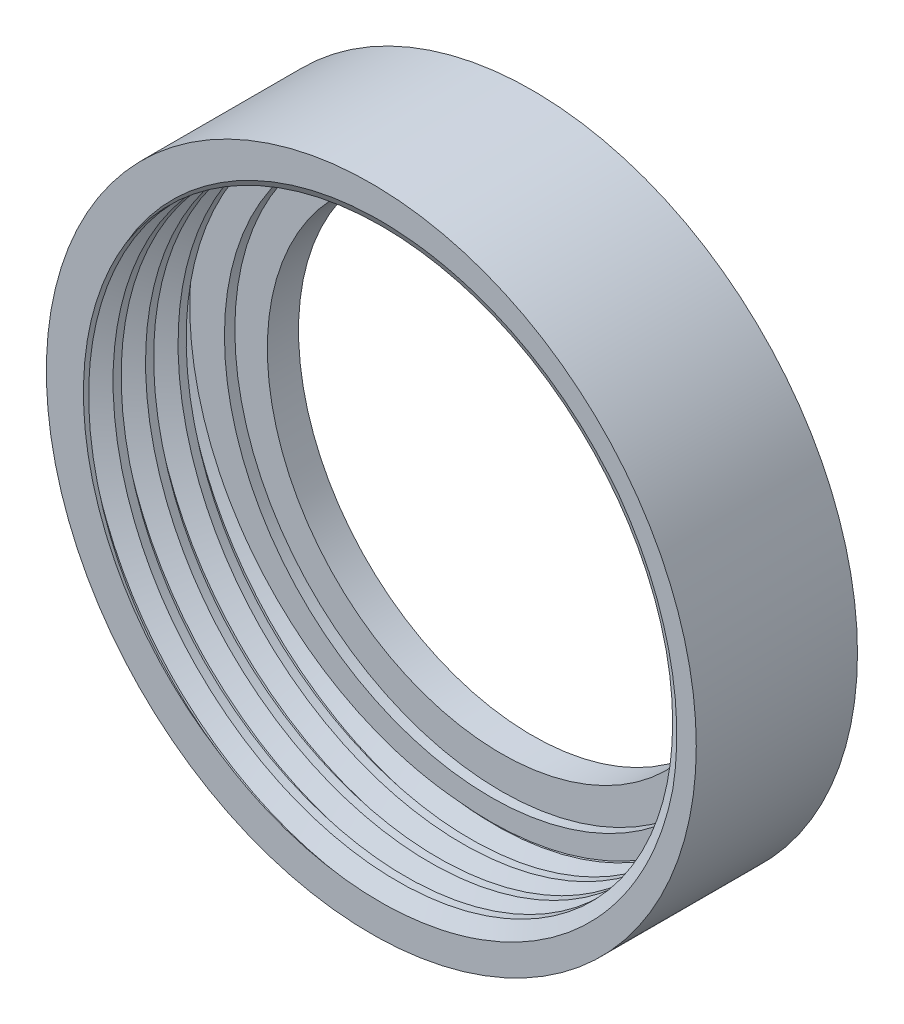
from build123d import *

# Parameters (mm, degrees)
SKETCH_2_R      = 12.5
SKETCH_2_R_2    = 9
EXTRUDE_1_DEPTH = 1.2
SKETCH_3_R      = 12.5
SKETCH_3_R_2    = 11.75
EXTRUDE_2_DEPTH = 5
SKETCH_4_R      = 11.75
SKETCH_4_R_2    = 10.25
EXTRUDE_3_DEPTH = 0.4
THREAD_1_PITCH  = 1.25
THREAD_1_FROM   = 3


with BuildPart() as part:
    # 草图2 → 凸台-拉伸1 (new body)
    with BuildSketch(Plane.XY):
        Circle(SKETCH_2_R)
        Circle(SKETCH_2_R_2, mode=Mode.SUBTRACT)
    extrude(amount=EXTRUDE_1_DEPTH)

    # 草图3 → 凸台-拉伸2 (add)
    with BuildSketch(Plane.XY.offset(1.2)):
        Circle(SKETCH_3_R)
        Circle(SKETCH_3_R_2, mode=Mode.SUBTRACT)
    extrude(amount=EXTRUDE_2_DEPTH)

    # 草图4 → 凸台-拉伸3 (add)
    with BuildSketch(Plane.XY.offset(1.2)):
        Circle(SKETCH_4_R)
        Circle(SKETCH_4_R_2, mode=Mode.SUBTRACT)
    extrude(amount=EXTRUDE_3_DEPTH)

    # 螺纹线1: arcs per turn and ends read off the stored shape
    # 螺纹线1: the profile of 螺纹线轮廓1 profile screwed along a right-hand helix through 6.08 turns, 8 arcs to a turn; built about Z, then put on its axis
    thread_1_z = Axis((0, 0, 0), (0, 0, 1))
    thread_1_corners = [(11.7503, 0, -0.000173205), (11.7503, 0, 1.093923202), (11.073417656, 0, 0.703124998), (11.073417656, 0, 0.390624998)]
    with BuildLine(mode=Mode.PRIVATE) as thread_1_profile:
        Line(thread_1_corners[0], thread_1_corners[1])
        Line(thread_1_corners[1], thread_1_corners[2])
        Line(thread_1_corners[2], thread_1_corners[3])
        Line(thread_1_corners[3], thread_1_corners[0])
    thread_1_cap = Face(thread_1_profile.wire())
    thread_1_turn_angles = [0, 22.5, 45, 67.5, 90, 112.5, 135, 157.5, 180, 202.5, 225, 247.5, 270, 292.5, 315, 337.5, 360]
    thread_1_turn_weights = [1, 0.9238795325112867, 1, 0.9238795325112867, 1, 0.9238795325112867, 1, 0.9238795325112867, 1, 0.9238795325112867, 1, 0.9238795325112867, 1, 0.9238795325112867, 1, 0.9238795325112867, 1]
    thread_1_turn_rails = [Edge.make_bspline([Vector(p[0], p[1], 0).rotate(thread_1_z, thread_1_turn_angles[k]) / thread_1_turn_weights[k] + Vector(0, 0, p[2] + THREAD_1_PITCH * thread_1_turn_angles[k] / 360) for k in range(17)], [0, 0, 0, 1, 1, 2, 2, 3, 3, 4, 4, 5, 5, 6, 6, 7, 7, 8, 8, 8], 2, thread_1_turn_weights) for p in thread_1_corners]
    thread_1_turn_sides = [Face.make_surface_from_curves(thread_1_turn_rails[p[0]], thread_1_turn_rails[p[1]]) for p in [(0, 1), (1, 2), (2, 3), (3, 0)]]
    thread_1_last_angles = [2160, 2174.4, 2188.8]
    thread_1_last_weights = [1, 0.9685831611286307, 1]
    thread_1_last_rails = [Edge.make_bspline([Vector(p[0], p[1], 0).rotate(thread_1_z, thread_1_last_angles[k]) / thread_1_last_weights[k] + Vector(0, 0, p[2] + THREAD_1_PITCH * thread_1_last_angles[k] / 360) for k in range(3)], [0, 0, 0, 1, 1, 1], 2, thread_1_last_weights) for p in thread_1_corners]
    thread_1_last_sides = [Face.make_surface_from_curves(thread_1_last_rails[p[0]], thread_1_last_rails[p[1]]) for p in [(0, 1), (1, 2), (2, 3), (3, 0)]]
    thread_1 = Plane(origin=(0, 0, 9.2), x_dir=(-1, 0, 0), z_dir=(0, 0, -1)) * split(Solid(Shell([*[p.moved(Location((0, 0, THREAD_1_PITCH * i))) for i in range(6) for p in thread_1_turn_sides], *thread_1_last_sides, thread_1_cap, thread_1_cap.rotate(thread_1_z, 2188.8).moved(Location((0, 0, THREAD_1_PITCH * 2188.8 / 360)))])), bisect_by=Plane.XY.offset(THREAD_1_FROM), keep=Keep.TOP, mode=Mode.PRIVATE)
    add(thread_1)


solid = part.part
